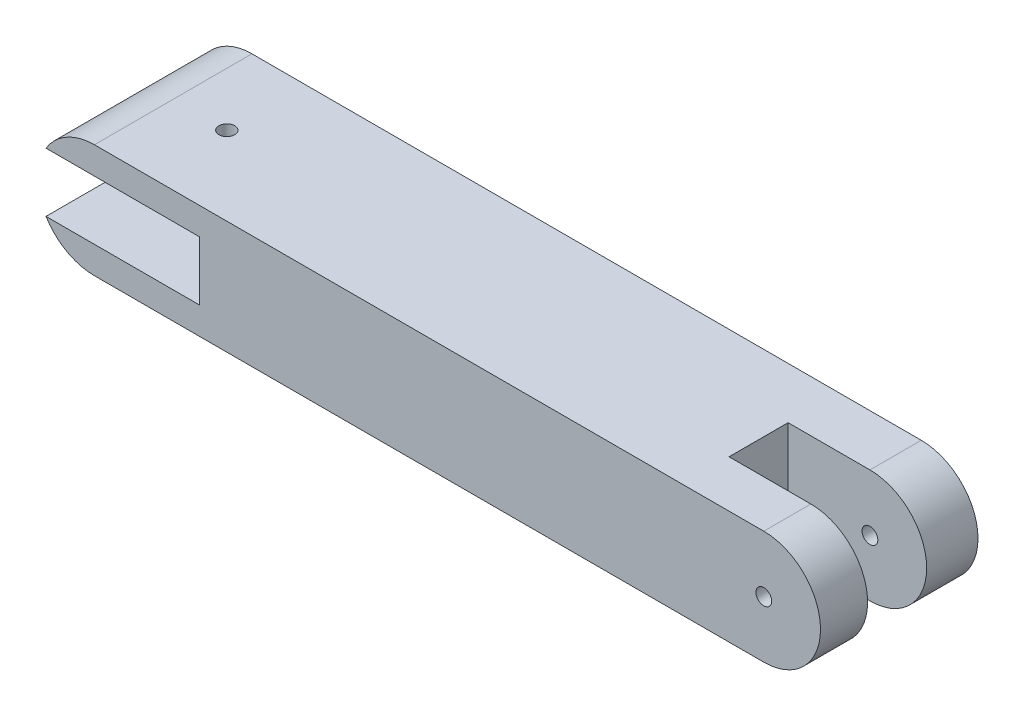
from build123d import *

# Parameters (mm, degrees)
RESSALTO_EXTRUS_O1_DEPTH = 40
ESBO_O2_R                = 2
CORTE_EXTRUS_O1_DEPTH    = 40
ESBO_O3_W                = 42.59573723
ESBO_O3_H                = 15
CORTE_EXTRUS_O2_DEPTH    = 40
ESBO_O4_R                = 2
CORTE_EXTRUS_O3_DEPTH    = 40
ESBO_O6_W                = 41.568390607
ESBO_O6_H                = 15
CORTE_EXTRUS_O5_DEPTH    = 62.5


with BuildPart() as part:
    # Esboço1 → Ressalto-extrusão1 (new body)
    with BuildSketch(Plane.XY):
        with BuildLine():
            Line((-76.556913458, 14.405805893), (93.443086542, 14.405805893))
            ThreePointArc((93.443086542, 14.405805893), (107.848892435, 0), (93.443086542, -14.405805893))
            Line((93.443086542, -14.405805893), (-76.556913458, -14.405805893))
            ThreePointArc((-76.556913458, -14.405805893), (-90.96271935, 0), (-76.556913458, 14.405805893))
        make_face()
    extrude(amount=RESSALTO_EXTRUS_O1_DEPTH)

    # Esboço2 → Corte-extrusão1 (cut, symmetric)
    with BuildSketch(Plane.XY.offset(40)):
        with Locations((93.443086542, 0)):
            Circle(ESBO_O2_R)
    extrude(amount=CORTE_EXTRUS_O1_DEPTH, both=True, mode=Mode.SUBTRACT)

    # Esboço3 → Corte-extrusão2 (cut, symmetric)
    with BuildSketch(Plane.XY.offset(40)):
        with Locations((-71.144295171, 0)):
            Rectangle(ESBO_O3_W, ESBO_O3_H)
    extrude(amount=CORTE_EXTRUS_O2_DEPTH, both=True, mode=Mode.SUBTRACT)

    # Esboço4 → Corte-extrusão3 (cut, symmetric)
    with BuildSketch(Plane(origin=(0, 14.405805893, 0), x_dir=(1, 0, 0), z_dir=(0, 1, 0))):
        with Locations((-62.942269333, -20)):
            Circle(ESBO_O4_R)
    extrude(amount=CORTE_EXTRUS_O3_DEPTH, both=True, mode=Mode.SUBTRACT)

    # Esboço6 → Corte-extrusão5 (cut, symmetric)
    with BuildSketch(Plane(origin=(0, 14.405805893, 0), x_dir=(1, 0, 0), z_dir=(0, 1, 0))):
        with Locations((93.447225037, -20.540511229)):
            Rectangle(ESBO_O6_W, ESBO_O6_H)
    extrude(amount=CORTE_EXTRUS_O5_DEPTH, both=True, mode=Mode.SUBTRACT)


solid = part.part
